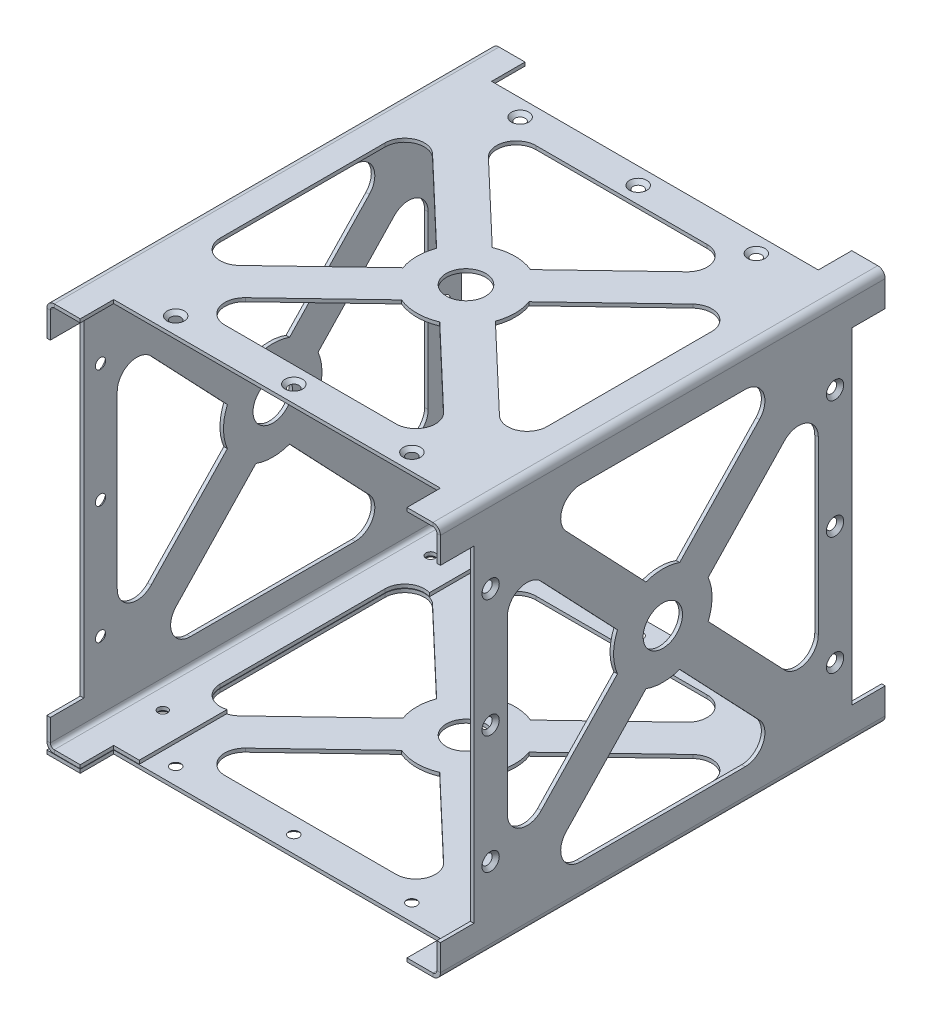
from build123d import *

# Parameters (mm, degrees)
SKETCH8_W                                        = 100
SKETCH8_H                                        = 113
BASE_FLANGE2_DEPTH                               = 0.9
EDGE_FLANGE1_STRIP_W                             = 5.6
EDGE_FLANGE1_STRIP_H                             = 0.9
EDGE_FLANGE1_STRIP_CUT_DEPTH                     = 113
EDGE_FLANGE1_DEPTH                               = 113
EDGE_FLANGE2_STRIP_W                             = 5.6
EDGE_FLANGE2_STRIP_H                             = 0.9
EDGE_FLANGE2_STRIP_CUT_DEPTH                     = 113
EDGE_FLANGE2_DEPTH                               = 113
EDGE_FLANGE3_STRIP_W                             = 5.6
EDGE_FLANGE3_STRIP_H                             = 0.9
EDGE_FLANGE3_STRIP_CUT_DEPTH                     = 113
EDGE_FLANGE3_DEPTH                               = 113
EDGE_FLANGE4_START                               = -43.131587293
EDGE_FLANGE4_DEPTH                               = 113
EDGE_FLANGE4_2_DEPTH                             = 113
SKETCH23_W                                       = 8.5
SKETCH23_H                                       = 83
CUT_EXTRUDE5_DEPTH                               = 10
SKETCH24_W                                       = 83
SKETCH24_H                                       = 8.5
CUT_EXTRUDE6_DEPTH                               = 10
CUT_EXTRUDE7_START                               = -10
SKETCH25_W                                       = 8.5
SKETCH25_H                                       = 83
CUT_EXTRUDE7_DEPTH                               = 10
CUT_EXTRUDE8_START                               = -10
SKETCH26_W                                       = 83
SKETCH26_H                                       = 8.5
CUT_EXTRUDE8_DEPTH                               = 10
CSK_FOR_M2_FLAT_HEAD_MACHINE_SCREW6_D            = 2.4
CSK_FOR_M2_FLAT_HEAD_MACHINE_SCREW6_CSINK_D      = 4.4
CSK_FOR_M2_FLAT_HEAD_MACHINE_SCREW6_CSINK_ANGLE  = 90
CSK_START                                        = 0.1
CSK_FOR_M2_FLAT_HEAD_MACHINE_SCREW7_OUTL_R       = 1.2
CSK_FOR_M2_FLAT_HEAD_MACHINE_SCREW7_DEPTH        = 0.9
CSK_FOR_M2_FLAT_HEAD_MACHINE_SCREW8_D            = 2.4
CSK_FOR_M2_FLAT_HEAD_MACHINE_SCREW8_CSINK_D      = 4.4
CSK_FOR_M2_FLAT_HEAD_MACHINE_SCREW8_CSINK_ANGLE  = 90
CSK_FOR_M2_FLAT_HEAD_MACHINE_SCREW9_D            = 2.4
CSK_FOR_M2_FLAT_HEAD_MACHINE_SCREW9_CSINK_D      = 4.4
CSK_FOR_M2_FLAT_HEAD_MACHINE_SCREW9_CSINK_ANGLE  = 90
CSK_FOR_M2_FLAT_HEAD_MACHINE_SCREW10_D           = 2.4
CSK_FOR_M2_FLAT_HEAD_MACHINE_SCREW10_CSINK_D     = 4.4
CSK_FOR_M2_FLAT_HEAD_MACHINE_SCREW10_CSINK_ANGLE = 90


# Read off the part's stored shape, not the designer's step: Edge-Flange4, CSK for M2 Flat Head Machine Screw2, CSK for M2 Flat Head Machine Screw3, CSK for M2 Flat Head Machine Screw4, CSK for M2 Flat Head Machine Screw5, CSK for M2 Flat Head Machine Screw7
# Sheet-metal steps are written as plain solids
with BuildPart() as part:
    # Sketch8 → Base-Flange2 (new body)
    with BuildSketch(Plane(origin=(0, 0, 0), x_dir=(1, 0, 0), z_dir=(0, 1, 0))):
        with Locations((33.022443423, -13.368412707)):
            Rectangle(SKETCH8_W, SKETCH8_H)
    extrude(amount=-BASE_FLANGE2_DEPTH)

    # Edge-Flange1 strip (across the edge) → Edge-Flange1 strip cut (cut)
    with BuildSketch(Plane(origin=(83.022443423, 0, 69.868412707), x_dir=(-1, 0, 0), z_dir=(0, 0, -1))):
        with Locations((-0.9, -0.45)):
            Rectangle(EDGE_FLANGE1_STRIP_W, EDGE_FLANGE1_STRIP_H)
    extrude(amount=EDGE_FLANGE1_STRIP_CUT_DEPTH, mode=Mode.SUBTRACT)

    # Edge-Flange1 section (across the edge) → Edge-Flange1 (add)
    with BuildSketch(Plane(origin=(83.022443423, 0, 69.868412707), x_dir=(-1, 0, 0), z_dir=(0, 0, -1))):
        with BuildLine():
            Line((0, 1), (0, 99.1))
            Line((0, 99.1), (0.9, 99.1))
            Line((0.9, 99.1), (0.9, 1))
            ThreePointArc((0.9, 1), (1.192893219, 0.292893219), (1.9, 0))
            Line((1.9, 0), (1.9, -0.9))
            ThreePointArc((1.9, -0.9), (0.556497116, -0.343502884), (0, 1))
        make_face()
    extrude(amount=EDGE_FLANGE1_DEPTH)

    # Edge-Flange2 strip (across the edge) → Edge-Flange2 strip cut (cut)
    with BuildSketch(Plane(origin=(82.122443423, 99.1, 69.868412707), x_dir=(0, -1, 0), z_dir=(0, 0, -1))):
        with Locations((-0.9, -0.45)):
            Rectangle(EDGE_FLANGE2_STRIP_W, EDGE_FLANGE2_STRIP_H)
    extrude(amount=EDGE_FLANGE2_STRIP_CUT_DEPTH, mode=Mode.SUBTRACT)

    # Edge-Flange2 section (across the edge) → Edge-Flange2 (add)
    with BuildSketch(Plane(origin=(82.122443423, 99.1, 69.868412707), x_dir=(0, -1, 0), z_dir=(0, 0, -1))):
        with BuildLine():
            Line((0, 1), (0, 99.1))
            Line((0, 99.1), (0.9, 99.1))
            Line((0.9, 99.1), (0.9, 1))
            ThreePointArc((0.9, 1), (1.192893219, 0.292893219), (1.9, 0))
            Line((1.9, 0), (1.9, -0.9))
            ThreePointArc((1.9, -0.9), (0.556497116, -0.343502884), (0, 1))
        make_face()
    extrude(amount=EDGE_FLANGE2_DEPTH)

    # Edge-Flange3 strip (across the edge) → Edge-Flange3 strip cut (cut)
    with BuildSketch(Plane(origin=(-16.977556577, 98.2, 69.868412707), x_dir=(1, 0, 0), z_dir=(0, 0, -1))):
        with Locations((-0.9, -0.45)):
            Rectangle(EDGE_FLANGE3_STRIP_W, EDGE_FLANGE3_STRIP_H)
    extrude(amount=EDGE_FLANGE3_STRIP_CUT_DEPTH, mode=Mode.SUBTRACT)

    # Edge-Flange3 section (across the edge) → Edge-Flange3 (add)
    with BuildSketch(Plane(origin=(-16.977556577, 98.2, 69.868412707), x_dir=(1, 0, 0), z_dir=(0, 0, -1))):
        with BuildLine():
            Line((0, 1), (0, 98.1))
            Line((0, 98.1), (0.9, 98.1))
            Line((0.9, 98.1), (0.9, 1))
            ThreePointArc((0.9, 1), (1.192893219, 0.292893219), (1.9, 0))
            Line((1.9, 0), (1.9, -0.9))
            ThreePointArc((1.9, -0.9), (0.556497116, -0.343502884), (0, 1))
        make_face()
    extrude(amount=EDGE_FLANGE3_DEPTH)

    # Edge-Flange4 outline → Edge-Flange4 (cut)
    with BuildSketch(Plane.XY.offset(EDGE_FLANGE4_START)):
        with BuildLine():
            Line((-16.077556577, 0.1), (-16.077556577, 0.384450558))
            ThreePointArc((-16.077556577, 0.384450558), (-16.737375844, 1.0753379), (-16.977556577, 2))
            Line((-16.977556577, 2), (-16.977556577, 0.1))
            Line((-16.977556577, 0.1), (-16.077556577, 0.1))
        make_face()
    extrude(amount=EDGE_FLANGE4_DEPTH, mode=Mode.SUBTRACT)

    # Edge-Flange4 2 outline → Edge-Flange4 2 (add)
    with BuildSketch(Plane.XY.offset(EDGE_FLANGE4_START)):
        with BuildLine():
            ThreePointArc((-16.077556577, 0.384450558), (-15.597391195, 0.172495699), (-15.077556577, 0.1))
            Line((-15.077556577, 0.1), (-1.977556577, 0.1))
            Line((-1.977556577, 0.1), (-1.977556577, 1))
            Line((-1.977556577, 1), (-15.077556577, 1))
            ThreePointArc((-15.077556577, 1), (-15.784663358, 1.292893219), (-16.077556577, 2))
            Line((-16.077556577, 2), (-16.077556577, 0.384450558))
        make_face()
    extrude(amount=EDGE_FLANGE4_2_DEPTH)

    # Sketch23 → Cut-Extrude5 (cut)
    with BuildSketch(Plane(origin=(83.022443423, 0, 0), x_dir=(0, 0, -1), z_dir=(1, 0, 0))):
        with BuildLine():
            Line((-1.848189849, 44.248766622), (17.509860102, 23.910562244))
            ThreePointArc((17.509860102, 23.910562244), (22.987842131, 22.715085554), (26.131587293, 27.357748365))
            Line((26.131587293, 27.357748365), (26.131587293, 70.842251635))
            ThreePointArc((26.131587293, 70.842251635), (22.987842131, 75.484914446), (17.509860102, 74.289437756))
            Line((17.509860102, 74.289437756), (-1.848189849, 53.951233378))
            ThreePointArc((-1.848189849, 53.951233378), (-1.115805113, 51.574592317), (-0.868412707, 49.1))
            ThreePointArc((-0.868412707, 49.1), (-1.115805113, 46.625407683), (-1.848189849, 44.248766622))
        make_face()
        with BuildLine():
            ThreePointArc((-17.645181184, 60.845605621), (-13.368412707, 61.6), (-9.09164423, 60.845605621))
            Line((-9.09164423, 60.845605621), (11.188710618, 82.152813879))
            ThreePointArc((11.188710618, 82.152813879), (12.162412167, 87.570287973), (7.566983427, 90.6))
            Line((7.566983427, 90.6), (-34.303808842, 90.6))
            ThreePointArc((-34.303808842, 90.6), (-38.899237582, 87.570287973), (-37.925536032, 82.152813879))
            Line((-37.925536032, 82.152813879), (-17.645181184, 60.845605621))
        make_face()
        with BuildLine():
            ThreePointArc((-8.368412707, 49.1), (-8.725749896, 50.956254838), (-9.746685516, 52.547186121))
            ThreePointArc((-9.746685516, 52.547186121), (-9.832878801, 52.635533906), (-9.921226586, 52.721727191))
            Line((-9.921226586, 52.721727191), (-13.368412707, 49.1))
            Line((-13.368412707, 49.1), (-9.921226586, 45.478272809))
            ThreePointArc((-9.921226586, 45.478272809), (-9.832878801, 45.564466094), (-9.746685516, 45.652813879))
            ThreePointArc((-9.746685516, 45.652813879), (-8.725749896, 47.243745162), (-8.368412707, 49.1))
        make_face()
        with BuildLine():
            Line((-13.368412707, 49.1), (-9.921226586, 52.721727191))
            ThreePointArc((-9.921226586, 52.721727191), (-13.368412707, 54.1), (-16.815598829, 52.721727191))
            Line((-16.815598829, 52.721727191), (-13.368412707, 49.1))
        make_face()
        with BuildLine():
            Line((-16.815598829, 45.478272809), (-13.368412707, 49.1))
            Line((-13.368412707, 49.1), (-16.815598829, 52.721727191))
            ThreePointArc((-16.815598829, 52.721727191), (-16.903946613, 52.635533906), (-16.990139898, 52.547186121))
            ThreePointArc((-16.990139898, 52.547186121), (-18.368412707, 49.1), (-16.990139898, 45.652813879))
            ThreePointArc((-16.990139898, 45.652813879), (-16.903946613, 45.564466094), (-16.815598829, 45.478272809))
        make_face()
        with BuildLine():
            Line((-9.921226586, 45.478272809), (-13.368412707, 49.1))
            Line((-13.368412707, 49.1), (-16.815598829, 45.478272809))
            ThreePointArc((-16.815598829, 45.478272809), (-13.368412707, 44.1), (-9.921226586, 45.478272809))
        make_face()
        with BuildLine():
            Line((11.188710618, 16.047186121), (-9.09164423, 37.354394379))
            ThreePointArc((-9.09164423, 37.354394379), (-13.368412707, 36.6), (-17.645181184, 37.354394379))
            Line((-17.645181184, 37.354394379), (-37.925536032, 16.047186121))
            ThreePointArc((-37.925536032, 16.047186121), (-38.899237582, 10.629712027), (-34.303808842, 7.6))
            Line((-34.303808842, 7.6), (7.566983427, 7.6))
            ThreePointArc((7.566983427, 7.6), (12.162412167, 10.629712027), (11.188710618, 16.047186121))
        make_face()
        with BuildLine():
            Line((-44.246685516, 23.910562244), (-24.888635566, 44.248766622))
            ThreePointArc((-24.888635566, 44.248766622), (-25.868412707, 49.1), (-24.888635566, 53.951233378))
            Line((-24.888635566, 53.951233378), (-44.246685516, 74.289437756))
            ThreePointArc((-44.246685516, 74.289437756), (-49.724667545, 75.484914446), (-52.868412707, 70.842251635))
            Line((-52.868412707, 70.842251635), (-52.868412707, 27.357748365))
            ThreePointArc((-52.868412707, 27.357748365), (-49.724667545, 22.715085554), (-44.246685516, 23.910562244))
        make_face()
        with Locations((-65.618412707, 49.1)):
            Rectangle(SKETCH23_W, SKETCH23_H)
        with Locations((38.881587293, 49.1)):
            Rectangle(SKETCH23_W, SKETCH23_H)
    extrude(amount=-CUT_EXTRUDE5_DEPTH, mode=Mode.SUBTRACT)

    # Sketch24 → Cut-Extrude6 (cut)
    with BuildSketch(Plane(origin=(0, 99.1, 0), x_dir=(1, 0, 0), z_dir=(0, 1, 0))):
        with Locations((33.022443423, 38.881587293)):
            Rectangle(SKETCH24_W, SKETCH24_H)
        with BuildLine():
            Line((37.873676801, -1.848189849), (58.211881179, 17.509860102))
            ThreePointArc((58.211881179, 17.509860102), (59.407357869, 22.987842131), (54.764695058, 26.131587293))
            Line((54.764695058, 26.131587293), (11.280191788, 26.131587293))
            ThreePointArc((11.280191788, 26.131587293), (6.637528977, 22.987842131), (7.833005667, 17.509860102))
            Line((7.833005667, 17.509860102), (28.171210045, -1.848189849))
            ThreePointArc((28.171210045, -1.848189849), (33.022443423, -0.868412707), (37.873676801, -1.848189849))
        make_face()
        with BuildLine():
            ThreePointArc((21.276837803, -17.645181184), (20.522443423, -13.368412707), (21.276837803, -9.09164423))
            Line((21.276837803, -9.09164423), (-0.030370455, 11.188710618))
            ThreePointArc((-0.030370455, 11.188710618), (-5.44784455, 12.162412167), (-8.477556577, 7.566983427))
            Line((-8.477556577, 7.566983427), (-8.477556577, -34.303808842))
            ThreePointArc((-8.477556577, -34.303808842), (-5.44784455, -38.899237582), (-0.030370455, -37.925536032))
            Line((-0.030370455, -37.925536032), (21.276837803, -17.645181184))
        make_face()
        with BuildLine():
            ThreePointArc((36.469629545, -9.746685516), (33.022443423, -8.368412707), (29.575257302, -9.746685516))
            ThreePointArc((29.575257302, -9.746685516), (29.486909517, -9.832878801), (29.400716232, -9.921226586))
            Line((29.400716232, -9.921226586), (33.022443423, -13.368412707))
            Line((33.022443423, -13.368412707), (36.644170614, -9.921226586))
            ThreePointArc((36.644170614, -9.921226586), (36.557977329, -9.832878801), (36.469629545, -9.746685516))
        make_face()
        with BuildLine():
            Line((33.022443423, -13.368412707), (29.400716232, -9.921226586))
            ThreePointArc((29.400716232, -9.921226586), (28.022443423, -13.368412707), (29.400716232, -16.815598829))
            Line((29.400716232, -16.815598829), (33.022443423, -13.368412707))
        make_face()
        with BuildLine():
            ThreePointArc((38.022443423, -13.368412707), (37.665106234, -11.512157869), (36.644170614, -9.921226586))
            Line((36.644170614, -9.921226586), (33.022443423, -13.368412707))
            Line((33.022443423, -13.368412707), (36.644170614, -16.815598829))
            ThreePointArc((36.644170614, -16.815598829), (37.665106234, -15.224667545), (38.022443423, -13.368412707))
        make_face()
        with BuildLine():
            Line((36.644170614, -16.815598829), (33.022443423, -13.368412707))
            Line((33.022443423, -13.368412707), (29.400716232, -16.815598829))
            ThreePointArc((29.400716232, -16.815598829), (29.486909735, -16.903946831), (29.575257747, -16.990140322))
            ThreePointArc((29.575257747, -16.990140322), (33.022444101, -18.368412707), (36.469630082, -16.990139387))
            ThreePointArc((36.469630082, -16.990139387), (36.557977591, -16.903946351), (36.644170614, -16.815598829))
        make_face()
        with BuildLine():
            Line((58.211881179, -44.246685516), (37.873676801, -24.888635566))
            ThreePointArc((37.873676801, -24.888635566), (33.022443423, -25.868412707), (28.171210045, -24.888635566))
            Line((28.171210045, -24.888635566), (7.833005667, -44.246685516))
            ThreePointArc((7.833005667, -44.246685516), (6.637528977, -49.724667545), (11.280191788, -52.868412707))
            Line((11.280191788, -52.868412707), (54.764695058, -52.868412707))
            ThreePointArc((54.764695058, -52.868412707), (59.407357869, -49.724667545), (58.211881179, -44.246685516))
        make_face()
        with BuildLine():
            Line((66.075257302, 11.188710618), (44.768049044, -9.09164423))
            ThreePointArc((44.768049044, -9.09164423), (45.332400171, -11.197015721), (45.522443423, -13.368412707))
            ThreePointArc((45.522443423, -13.368412707), (45.332400171, -15.539809693), (44.768049044, -17.645181184))
            Line((44.768049044, -17.645181184), (66.075257302, -37.925536032))
            ThreePointArc((66.075257302, -37.925536032), (71.492731396, -38.899237582), (74.522443423, -34.303808842))
            Line((74.522443423, -34.303808842), (74.522443423, 7.566983427))
            ThreePointArc((74.522443423, 7.566983427), (71.492731396, 12.162412167), (66.075257302, 11.188710618))
        make_face()
        with Locations((33.022443423, -65.618412707)):
            Rectangle(SKETCH24_W, SKETCH24_H)
    extrude(amount=-CUT_EXTRUDE6_DEPTH, mode=Mode.SUBTRACT)

    # Sketch25 → Cut-Extrude7 (cut)
    with BuildSketch(Plane.ZY.offset(16.977556577).offset(CUT_EXTRUDE7_START)):
        with BuildLine():
            Line((-11.188710618, 82.152813879), (9.09164423, 60.845605621))
            ThreePointArc((9.09164423, 60.845605621), (13.368412707, 61.6), (17.645181184, 60.845605621))
            Line((17.645181184, 60.845605621), (37.925536032, 82.152813879))
            ThreePointArc((37.925536032, 82.152813879), (38.899237582, 87.570287973), (34.303808842, 90.6))
            Line((34.303808842, 90.6), (-7.566983427, 90.6))
            ThreePointArc((-7.566983427, 90.6), (-12.162412167, 87.570287973), (-11.188710618, 82.152813879))
        make_face()
        with BuildLine():
            Line((1.848189849, 53.951233378), (-17.509860102, 74.289437756))
            ThreePointArc((-17.509860102, 74.289437756), (-22.987842131, 75.484914446), (-26.131587293, 70.842251635))
            Line((-26.131587293, 70.842251635), (-26.131587293, 27.357748365))
            ThreePointArc((-26.131587293, 27.357748365), (-22.987842131, 22.715085554), (-17.509860102, 23.910562244))
            Line((-17.509860102, 23.910562244), (1.848189849, 44.248766622))
            ThreePointArc((1.848189849, 44.248766622), (0.868412707, 49.1), (1.848189849, 53.951233378))
        make_face()
        with BuildLine():
            ThreePointArc((17.645181184, 37.354394379), (13.368412707, 36.6), (9.09164423, 37.354394379))
            Line((9.09164423, 37.354394379), (-11.188710618, 16.047186121))
            ThreePointArc((-11.188710618, 16.047186121), (-12.162412167, 10.629712027), (-7.566983427, 7.6))
            Line((-7.566983427, 7.6), (34.303808842, 7.6))
            ThreePointArc((34.303808842, 7.6), (38.899237582, 10.629712027), (37.925536032, 16.047186121))
            Line((37.925536032, 16.047186121), (17.645181184, 37.354394379))
        make_face()
        with BuildLine():
            Line((44.246685516, 74.289437756), (24.888635566, 53.951233378))
            ThreePointArc((24.888635566, 53.951233378), (25.621020302, 51.574592317), (25.868412707, 49.1))
            ThreePointArc((25.868412707, 49.1), (25.621020302, 46.625407683), (24.888635566, 44.248766622))
            Line((24.888635566, 44.248766622), (44.246685516, 23.910562244))
            ThreePointArc((44.246685516, 23.910562244), (49.724667545, 22.715085554), (52.868412707, 27.357748365))
            Line((52.868412707, 27.357748365), (52.868412707, 70.842251635))
            ThreePointArc((52.868412707, 70.842251635), (49.724667545, 75.484914446), (44.246685516, 74.289437756))
        make_face()
        with Locations((65.618412707, 49.1)):
            Rectangle(SKETCH25_W, SKETCH25_H)
        with Locations((-38.881587293, 49.1)):
            Rectangle(SKETCH25_W, SKETCH25_H)
        with BuildLine():
            ThreePointArc((9.746685516, 52.547186121), (8.368412707, 49.1), (9.746685516, 45.652813879))
            ThreePointArc((9.746685516, 45.652813879), (9.832878801, 45.564466094), (9.921226586, 45.478272809))
            Line((9.921226586, 45.478272809), (13.368412707, 49.1))
            Line((13.368412707, 49.1), (9.921226586, 52.721727191))
            ThreePointArc((9.921226586, 52.721727191), (9.832878801, 52.635533906), (9.746685516, 52.547186121))
        make_face()
        with BuildLine():
            Line((13.368412707, 49.1), (9.921226586, 45.478272809))
            ThreePointArc((9.921226586, 45.478272809), (13.368412707, 44.1), (16.815598829, 45.478272809))
            Line((16.815598829, 45.478272809), (13.368412707, 49.1))
        make_face()
        with BuildLine():
            ThreePointArc((16.815598829, 52.721727191), (13.368412707, 54.1), (9.921226586, 52.721727191))
            Line((9.921226586, 52.721727191), (13.368412707, 49.1))
            Line((13.368412707, 49.1), (16.815598829, 52.721727191))
        make_face()
        with BuildLine():
            Line((16.815598829, 52.721727191), (13.368412707, 49.1))
            Line((13.368412707, 49.1), (16.815598829, 45.478272809))
            ThreePointArc((16.815598829, 45.478272809), (16.903946386, 45.564465867), (16.990139455, 45.652813413))
            ThreePointArc((16.990139455, 45.652813413), (18.011075399, 47.243744864), (18.368412707, 49.1))
            ThreePointArc((18.368412707, 49.1), (18.011075538, 50.956254788), (16.990139972, 52.547186044))
            ThreePointArc((16.990139972, 52.547186044), (16.903946651, 52.635533868), (16.815598829, 52.721727191))
        make_face()
    extrude(amount=CUT_EXTRUDE7_DEPTH, mode=Mode.SUBTRACT)

    # Sketch26 → Cut-Extrude8 (cut)
    with BuildSketch(Plane(origin=(0, -0.9, 0), x_dir=(-1, 0, 0), z_dir=(0, -1, 0)).offset(CUT_EXTRUDE8_START)):
        with BuildLine():
            Line((0.030370455, 11.188710618), (-21.276837803, -9.09164423))
            ThreePointArc((-21.276837803, -9.09164423), (-20.712486676, -11.197015721), (-20.522443423, -13.368412707))
            ThreePointArc((-20.522443423, -13.368412707), (-20.712486676, -15.539809693), (-21.276837803, -17.645181184))
            Line((-21.276837803, -17.645181184), (0.030370455, -37.925536032))
            ThreePointArc((0.030370455, -37.925536032), (5.44784455, -38.899237582), (8.477556577, -34.303808842))
            Line((8.477556577, -34.303808842), (8.477556577, 7.566983427))
            ThreePointArc((8.477556577, 7.566983427), (5.44784455, 12.162412167), (0.030370455, 11.188710618))
        make_face()
        with BuildLine():
            Line((-28.171210045, -1.848189849), (-7.833005667, 17.509860102))
            ThreePointArc((-7.833005667, 17.509860102), (-6.637528977, 22.987842131), (-11.280191788, 26.131587293))
            Line((-11.280191788, 26.131587293), (-54.764695058, 26.131587293))
            ThreePointArc((-54.764695058, 26.131587293), (-59.407357869, 22.987842131), (-58.211881179, 17.509860102))
            Line((-58.211881179, 17.509860102), (-37.873676801, -1.848189849))
            ThreePointArc((-37.873676801, -1.848189849), (-33.022443423, -0.868412707), (-28.171210045, -1.848189849))
        make_face()
        with BuildLine():
            ThreePointArc((-44.768049044, -17.645181184), (-45.522443423, -13.368412707), (-44.768049044, -9.09164423))
            Line((-44.768049044, -9.09164423), (-66.075257302, 11.188710618))
            ThreePointArc((-66.075257302, 11.188710618), (-71.492731396, 12.162412167), (-74.522443423, 7.566983427))
            Line((-74.522443423, 7.566983427), (-74.522443423, -34.303808842))
            ThreePointArc((-74.522443423, -34.303808842), (-71.492731396, -38.899237582), (-66.075257302, -37.925536032))
            Line((-66.075257302, -37.925536032), (-44.768049044, -17.645181184))
        make_face()
        with BuildLine():
            Line((-7.833005667, -44.246685516), (-28.171210045, -24.888635566))
            ThreePointArc((-28.171210045, -24.888635566), (-33.022443423, -25.868412707), (-37.873676801, -24.888635566))
            Line((-37.873676801, -24.888635566), (-58.211881179, -44.246685516))
            ThreePointArc((-58.211881179, -44.246685516), (-59.407357869, -49.724667545), (-54.764695058, -52.868412707))
            Line((-54.764695058, -52.868412707), (-11.280191788, -52.868412707))
            ThreePointArc((-11.280191788, -52.868412707), (-6.637528977, -49.724667545), (-7.833005667, -44.246685516))
        make_face()
        with Locations((-33.022443423, -65.618412707)):
            Rectangle(SKETCH26_W, SKETCH26_H)
        with Locations((-33.022443423, 38.881587293)):
            Rectangle(SKETCH26_W, SKETCH26_H)
        with BuildLine():
            ThreePointArc((-29.575257302, -9.746685516), (-33.022443423, -8.368412707), (-36.469629545, -9.746685516))
            ThreePointArc((-36.469629545, -9.746685516), (-36.557977329, -9.832878801), (-36.644170614, -9.921226586))
            Line((-36.644170614, -9.921226586), (-33.022443423, -13.368412707))
            Line((-33.022443423, -13.368412707), (-29.400716232, -9.921226586))
            ThreePointArc((-29.400716232, -9.921226586), (-29.486909517, -9.832878801), (-29.575257302, -9.746685516))
        make_face()
        with BuildLine():
            Line((-33.022443423, -13.368412707), (-36.644170614, -9.921226586))
            ThreePointArc((-36.644170614, -9.921226586), (-38.022443423, -13.368412707), (-36.644170614, -16.815598829))
            Line((-36.644170614, -16.815598829), (-33.022443423, -13.368412707))
        make_face()
        with BuildLine():
            ThreePointArc((-28.022443423, -13.368412707), (-28.379780612, -11.512157869), (-29.400716232, -9.921226586))
            Line((-29.400716232, -9.921226586), (-33.022443423, -13.368412707))
            Line((-33.022443423, -13.368412707), (-29.400716232, -16.815598829))
            ThreePointArc((-29.400716232, -16.815598829), (-28.379780612, -15.224667545), (-28.022443423, -13.368412707))
        make_face()
        with BuildLine():
            Line((-29.400716232, -16.815598829), (-33.022443423, -13.368412707))
            Line((-33.022443423, -13.368412707), (-36.644170614, -16.815598829))
            ThreePointArc((-36.644170614, -16.815598829), (-36.557977591, -16.903946351), (-36.469630082, -16.990139387))
            ThreePointArc((-36.469630082, -16.990139387), (-33.02244348, -18.368412707), (-29.575256847, -16.990139465))
            ThreePointArc((-29.575256847, -16.990139465), (-29.486909295, -16.903946391), (-29.400716232, -16.815598829))
        make_face()
    extrude(amount=CUT_EXTRUDE8_DEPTH, mode=Mode.SUBTRACT)

    # CSK for M2 Flat Head Machine Screw2 outl → CSK for M2 Flat Head Machine Screw2 (revolve, cut)
    with BuildSketch(Plane(origin=(63.022443423, 0, -30.381587293), x_dir=(1, 0, 0), z_dir=(0, 0, 1))):
        Polygon((2.2, 99.1), (0, 99.1), (0, 98.2), (1.3, 98.2), align=None)
    revolve(axis=Axis((63.022443423, 0, -30.381587293), (0, 1, 0)), mode=Mode.SUBTRACT)

    # CSK for M2 Flat Head Machine Screw2 2 ou → CSK for M2 Flat Head Machine Screw2 2 (revolve, cut)
    with BuildSketch(Plane(origin=(33.022443423, 0, -30.381587293), x_dir=(1, 0, 0), z_dir=(0, 0, 1))):
        Polygon((2.2, 99.1), (0, 99.1), (0, 98.2), (1.3, 98.2), align=None)
    revolve(axis=Axis((33.022443423, 0, -30.381587293), (0, 1, 0)), mode=Mode.SUBTRACT)

    # CSK for M2 Flat Head Machine Screw2 3 ou → CSK for M2 Flat Head Machine Screw2 3 (revolve, cut)
    with BuildSketch(Plane(origin=(3.022443423, 0, -30.381587293), x_dir=(1, 0, 0), z_dir=(0, 0, 1))):
        Polygon((2.2, 99.1), (0, 99.1), (0, 98.2), (1.3, 98.2), align=None)
    revolve(axis=Axis((3.022443423, 0, -30.381587293), (0, 1, 0)), mode=Mode.SUBTRACT)

    # CSK for M2 Flat Head Machine Screw3 outl → CSK for M2 Flat Head Machine Screw3 (revolve, cut)
    with BuildSketch(Plane(origin=(63.022443423, 0, 57.118412707), x_dir=(1, 0, 0), z_dir=(0, 0, 1))):
        Polygon((2.2, 99.1), (0, 99.1), (0, 98.2), (1.3, 98.2), align=None)
    revolve(axis=Axis((63.022443423, 0, 57.118412707), (0, 1, 0)), mode=Mode.SUBTRACT)

    # CSK for M2 Flat Head Machine Screw3 2 ou → CSK for M2 Flat Head Machine Screw3 2 (revolve, cut)
    with BuildSketch(Plane(origin=(33.022443423, 0, 57.118412707), x_dir=(1, 0, 0), z_dir=(0, 0, 1))):
        Polygon((2.2, 99.1), (0, 99.1), (0, 98.2), (1.3, 98.2), align=None)
    revolve(axis=Axis((33.022443423, 0, 57.118412707), (0, 1, 0)), mode=Mode.SUBTRACT)

    # CSK for M2 Flat Head Machine Screw3 3 ou → CSK for M2 Flat Head Machine Screw3 3 (revolve, cut)
    with BuildSketch(Plane(origin=(3.022443423, 0, 57.118412707), x_dir=(1, 0, 0), z_dir=(0, 0, 1))):
        Polygon((2.2, 99.1), (0, 99.1), (0, 98.2), (1.3, 98.2), align=None)
    revolve(axis=Axis((3.022443423, 0, 57.118412707), (0, 1, 0)), mode=Mode.SUBTRACT)

    # CSK for M2 Flat Head Machine Screw4 outl → CSK for M2 Flat Head Machine Screw4 (revolve, cut)
    with BuildSketch(Plane(origin=(0, 19.1, -30.381587293), x_dir=(0, 1, 0), z_dir=(0, 0, -1))):
        Polygon((0, -16.977556577), (2.2, -16.977556577), (1.3, -16.077556577), (0, -16.077556577), align=None)
    revolve(axis=Axis((0, 19.1, -30.381587293), (1, 0, 0)), mode=Mode.SUBTRACT)

    # CSK for M2 Flat Head Machine Screw4 2 ou → CSK for M2 Flat Head Machine Screw4 2 (revolve, cut)
    with BuildSketch(Plane(origin=(0, 49.1, -30.381587293), x_dir=(0, 1, 0), z_dir=(0, 0, -1))):
        Polygon((0, -16.977556577), (2.2, -16.977556577), (1.3, -16.077556577), (0, -16.077556577), align=None)
    revolve(axis=Axis((0, 49.1, -30.381587293), (1, 0, 0)), mode=Mode.SUBTRACT)

    # CSK for M2 Flat Head Machine Screw4 3 ou → CSK for M2 Flat Head Machine Screw4 3 (revolve, cut)
    with BuildSketch(Plane(origin=(0, 79.1, -30.381587293), x_dir=(0, 1, 0), z_dir=(0, 0, -1))):
        Polygon((0, -16.977556577), (2.2, -16.977556577), (1.3, -16.077556577), (0, -16.077556577), align=None)
    revolve(axis=Axis((0, 79.1, -30.381587293), (1, 0, 0)), mode=Mode.SUBTRACT)

    # CSK for M2 Flat Head Machine Screw5 outl → CSK for M2 Flat Head Machine Screw5 (revolve, cut)
    with BuildSketch(Plane(origin=(0, 79.1, 57.118412707), x_dir=(0, 1, 0), z_dir=(0, 0, -1))):
        Polygon((0, -16.977556577), (2.2, -16.977556577), (1.3, -16.077556577), (0, -16.077556577), align=None)
    revolve(axis=Axis((0, 79.1, 57.118412707), (1, 0, 0)), mode=Mode.SUBTRACT)

    # CSK for M2 Flat Head Machine Screw5 2 ou → CSK for M2 Flat Head Machine Screw5 2 (revolve, cut)
    with BuildSketch(Plane(origin=(0, 49.1, 57.118412707), x_dir=(0, 1, 0), z_dir=(0, 0, -1))):
        Polygon((0, -16.977556577), (2.2, -16.977556577), (1.3, -16.077556577), (0, -16.077556577), align=None)
    revolve(axis=Axis((0, 49.1, 57.118412707), (1, 0, 0)), mode=Mode.SUBTRACT)

    # CSK for M2 Flat Head Machine Screw5 3 ou → CSK for M2 Flat Head Machine Screw5 3 (revolve, cut)
    with BuildSketch(Plane(origin=(0, 19.1, 57.118412707), x_dir=(0, 1, 0), z_dir=(0, 0, -1))):
        Polygon((0, -16.977556577), (2.2, -16.977556577), (1.3, -16.077556577), (0, -16.077556577), align=None)
    revolve(axis=Axis((0, 19.1, 57.118412707), (1, 0, 0)), mode=Mode.SUBTRACT)

    # CSK for M2 Flat Head Machine Screw6 (through all)
    with Locations(Plane(origin=(86.306730827, -0.9, -24.907771762), x_dir=(-1, 0, 0), z_dir=(0, -1, 0))):
        with Locations((23.284287404, 5.473815531), (53.284287404, 5.473815531), (83.284287404, 5.473815531)):
            CounterSinkHole(CSK_FOR_M2_FLAT_HEAD_MACHINE_SCREW6_D / 2, CSK_FOR_M2_FLAT_HEAD_MACHINE_SCREW6_CSINK_D / 2, counter_sink_angle=CSK_FOR_M2_FLAT_HEAD_MACHINE_SCREW6_CSINK_ANGLE)

    # CSK for M2 Flat Head Machine Screw7 outl → CSK for M2 Flat Head Machine Screw7 (cut)
    with BuildSketch(Plane(origin=(0, 0, 0), x_dir=(1, 0, 0), z_dir=(0, 1, 0)).offset(CSK_START)):
        with Locations((-9.977556577, -47.39333969)):
            Circle(CSK_FOR_M2_FLAT_HEAD_MACHINE_SCREW7_OUTL_R)
        with Locations((-9.977556577, 20.656514276)):
            Circle(CSK_FOR_M2_FLAT_HEAD_MACHINE_SCREW7_OUTL_R)
    extrude(amount=CSK_FOR_M2_FLAT_HEAD_MACHINE_SCREW7_DEPTH, mode=Mode.SUBTRACT)

    # CSK for M2 Flat Head Machine Screw7 2 ou → CSK for M2 Flat Head Machine Screw7 2 (revolve, cut)
    with BuildSketch(Plane(origin=(-9.977556577, 0, 47.39333969), x_dir=(1, 0, 0), z_dir=(0, 0, 1))):
        Polygon((0, -0.9), (2.2, -0.9), (1.3, 0), (0, 0), align=None)
    revolve(axis=Axis((-9.977556577, 0, 47.39333969), (0, 1, 0)), mode=Mode.SUBTRACT)

    # CSK for M2 Flat Head Machine Screw7 3 ou → CSK for M2 Flat Head Machine Screw7 3 (revolve, cut)
    with BuildSketch(Plane(origin=(-9.977556577, 0, -20.656514276), x_dir=(1, 0, 0), z_dir=(0, 0, 1))):
        Polygon((0, -0.9), (2.2, -0.9), (1.3, 0), (0, 0), align=None)
    revolve(axis=Axis((-9.977556577, 0, -20.656514276), (0, 1, 0)), mode=Mode.SUBTRACT)

    # CSK for M2 Flat Head Machine Screw8 (through all)
    with Locations(Plane(origin=(86.306730827, -0.9, -24.907771762), x_dir=(-1, 0, 0), z_dir=(0, -1, 0))):
        with Locations((83.284287404, -82.026184469), (53.284287404, -82.026184469), (23.284287404, -82.026184469)):
            CounterSinkHole(CSK_FOR_M2_FLAT_HEAD_MACHINE_SCREW8_D / 2, CSK_FOR_M2_FLAT_HEAD_MACHINE_SCREW8_CSINK_D / 2, counter_sink_angle=CSK_FOR_M2_FLAT_HEAD_MACHINE_SCREW8_CSINK_ANGLE)

    # CSK for M2 Flat Head Machine Screw9 (through all)
    with Locations(Plane(origin=(83.022443423, 24.191898312, -24.907771762), x_dir=(0, -1, 0), z_dir=(1, 0, 0))):
        with Locations((-24.908101688, 5.473815531), (5.091898312, 5.473815531), (-54.908101688, 5.473815531)):
            CounterSinkHole(CSK_FOR_M2_FLAT_HEAD_MACHINE_SCREW9_D / 2, CSK_FOR_M2_FLAT_HEAD_MACHINE_SCREW9_CSINK_D / 2, counter_sink_angle=CSK_FOR_M2_FLAT_HEAD_MACHINE_SCREW9_CSINK_ANGLE)

    # CSK for M2 Flat Head Machine Screw10 (through all)
    with Locations(Plane(origin=(83.022443423, 24.191898312, -24.907771762), x_dir=(0, -1, 0), z_dir=(1, 0, 0))):
        with Locations((-24.908101688, -82.026184469), (5.091898312, -82.026184469), (-54.908101688, -82.026184469)):
            CounterSinkHole(CSK_FOR_M2_FLAT_HEAD_MACHINE_SCREW10_D / 2, CSK_FOR_M2_FLAT_HEAD_MACHINE_SCREW10_CSINK_D / 2, counter_sink_angle=CSK_FOR_M2_FLAT_HEAD_MACHINE_SCREW10_CSINK_ANGLE)


solid = part.part
